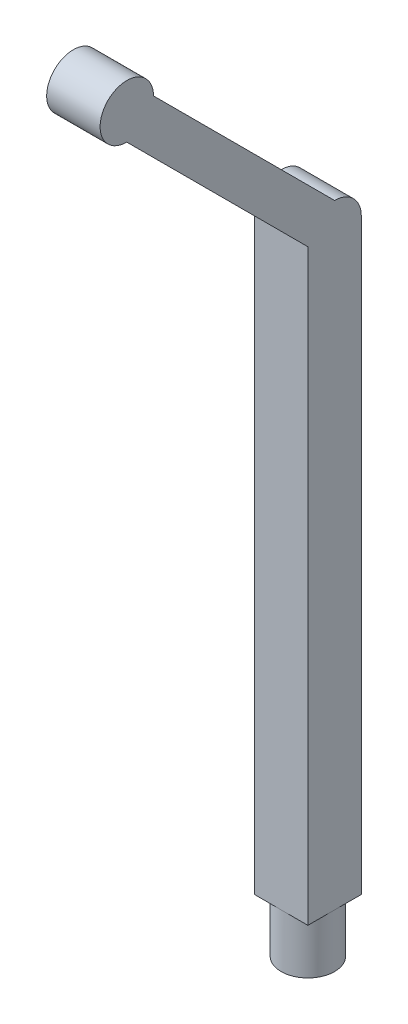
from build123d import *

# Parameters (mm, degrees)
EXTRUDE_2_DEPTH = 10
SKETCH_3_R      = 5
EXTRUDE_3_DEPTH = 10


with BuildPart() as part:
    # 草图1 → 凸台-拉伸2 (new body)
    with BuildSketch(Plane(origin=(0, 0, 0), x_dir=(0, 0, -1), z_dir=(1, 0, 0))):
        with BuildLine():
            Line((0, 60), (-33.890872965, 93.890872965))
            ThreePointArc((-33.890872965, 93.890872965), (-42.426406871, 97.426406871), (-38.890872965, 88.890872965))
            Line((-38.890872965, 88.890872965), (-5, 55))
            Line((-5, 55), (-5, -55))
            Line((-5, -55), (5, -55))
            Line((5, -55), (5, 55))
            ThreePointArc((5, 55), (3.535533906, 58.535533906), (0, 60))
        make_face()
    extrude(amount=EXTRUDE_2_DEPTH)

    # 草图3 → 凸台-拉伸3 (add)
    with BuildSketch(Plane.XZ.offset(55)):
        with Locations((5, 0)):
            Circle(SKETCH_3_R)
    extrude(amount=EXTRUDE_3_DEPTH)


solid = part.part
